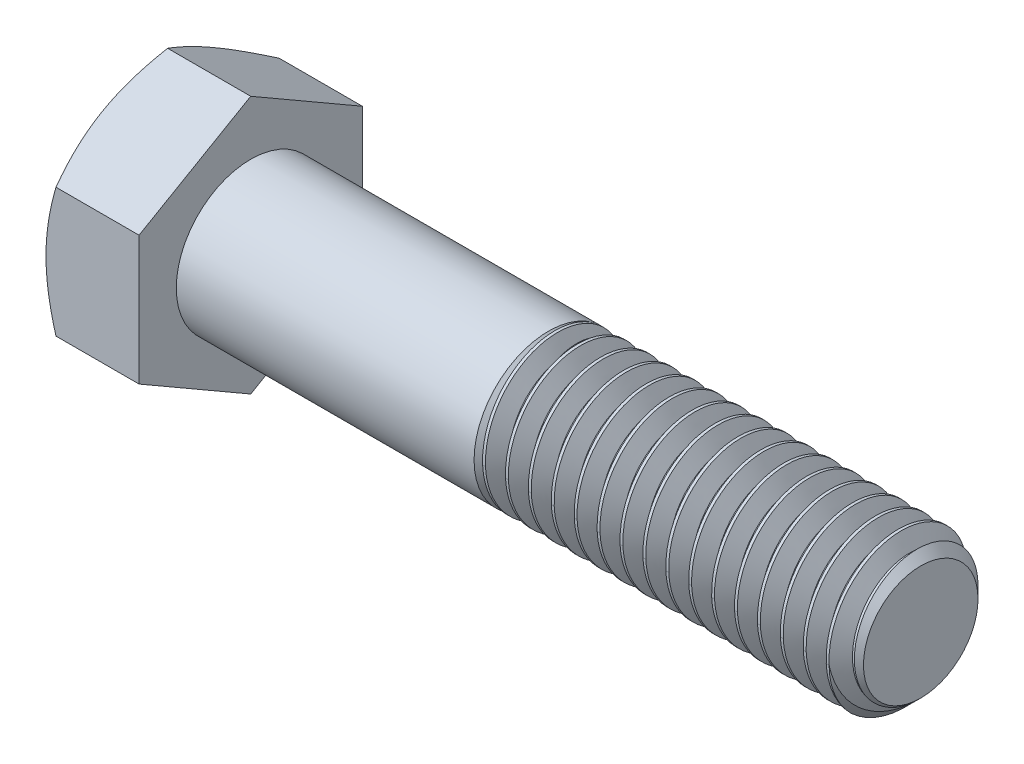
from build123d import *
from build123d.topology import SkipClean

# Parameters (mm, degrees)
SKETCH5_R           = 6.35
BOSS_EXTRUDE3_DEPTH = 57.15
CHAMFER1_SIZE       = 1.465384615
CUT_SWEEP1_PITCH    = 1.953846154
BOSS_EXTRUDE4_DEPTH = 7.9375
SKETCH8_OUTSIDE_W   = 269.808
SKETCH8_OUTSIDE_H   = 272.756
SKETCH8_OUTSIDE_R   = 9.525
CUT_EXTRUDE3_DEPTH  = 67.693896229
CUT_EXTRUDE3_DRAFT  = -60
CUT_EXTRUDE4_DEPTH  = 0.254
CIRPATTERN1_COUNT   = 3


with BuildPart() as part:
    # Sketch5 → Boss-Extrude3 (new body)
    with BuildSketch(Plane(origin=(32.54375, 0, 0), x_dir=(0, 0, -1), z_dir=(1, 0, 0))):
        Circle(SKETCH5_R)
    extrude(amount=-BOSS_EXTRUDE3_DEPTH)

    # Chamfer1
    chamfer1_edges = [part.edges().sort_by_distance(p)[0] for p in [
        (32.54375, 0, 6.35),
    ]]
    chamfer(chamfer1_edges, length=CHAMFER1_SIZE)

    # Cut-Sweep1: the profile of Sketch10 profile screwed along a right-hand helix of 17.25 turns, 10 arcs to a turn; built about Z, then put on its axis
    cut_sweep1_z = Axis((0, 0, 0), (0, 0, 1))
    cut_sweep1_corners = [(6.3503, 0, 0.000173205), (5.080939697, 0, -0.732692308), (5.080939697, 0, -0.976923077), (6.3503, 0, -1.70978859)]
    with BuildLine(mode=Mode.PRIVATE) as cut_sweep1_profile:
        Line(cut_sweep1_corners[0], cut_sweep1_corners[1])
        Line(cut_sweep1_corners[1], cut_sweep1_corners[2])
        Line(cut_sweep1_corners[2], cut_sweep1_corners[3])
        Line(cut_sweep1_corners[3], cut_sweep1_corners[0])
    cut_sweep1_cap = Face(cut_sweep1_profile.wire())
    cut_sweep1_turn_angles = [0, 18, 36, 54, 72, 90, 108, 126, 144, 162, 180, 198, 216, 234, 252, 270, 288, 306, 324, 342, 360]
    cut_sweep1_turn_weights = [1, 0.9510565162951535, 1, 0.9510565162951535, 1, 0.9510565162951535, 1, 0.9510565162951535, 1, 0.9510565162951535, 1, 0.9510565162951535, 1, 0.9510565162951535, 1, 0.9510565162951535, 1, 0.9510565162951535, 1, 0.9510565162951535, 1]
    cut_sweep1_turn_rails = [Edge.make_bspline([Vector(p[0], p[1], 0).rotate(cut_sweep1_z, cut_sweep1_turn_angles[k]) / cut_sweep1_turn_weights[k] + Vector(0, 0, p[2] + CUT_SWEEP1_PITCH * cut_sweep1_turn_angles[k] / 360) for k in range(21)], [0, 0, 0, 1, 1, 2, 2, 3, 3, 4, 4, 5, 5, 6, 6, 7, 7, 8, 8, 9, 9, 10, 10, 10], 2, cut_sweep1_turn_weights) for p in cut_sweep1_corners]
    cut_sweep1_turn_sides = [Face.make_surface_from_curves(cut_sweep1_turn_rails[p[0]], cut_sweep1_turn_rails[p[1]]) for p in [(0, 1), (1, 2), (2, 3), (3, 0)]]
    cut_sweep1_last_angles = [6120, 6138, 6156, 6174, 6192, 6201, 6210]
    cut_sweep1_last_weights = [1, 0.9510565162951535, 1, 0.9510565162951535, 1, 0.9876883405951787, 1]
    cut_sweep1_last_rails = [Edge.make_bspline([Vector(p[0], p[1], 0).rotate(cut_sweep1_z, cut_sweep1_last_angles[k]) / cut_sweep1_last_weights[k] + Vector(0, 0, p[2] + CUT_SWEEP1_PITCH * cut_sweep1_last_angles[k] / 360) for k in range(7)], [0, 0, 0, 1, 1, 2, 2, 3, 3, 3], 2, cut_sweep1_last_weights) for p in cut_sweep1_corners]
    cut_sweep1_last_sides = [Face.make_surface_from_curves(cut_sweep1_last_rails[p[0]], cut_sweep1_last_rails[p[1]]) for p in [(0, 1), (1, 2), (2, 3), (3, 0)]]
    cut_sweep1 = Plane(origin=(32.54375, 0, 0), x_dir=(0, 1, 0), z_dir=(-1, 0, 0)) * Solid(Shell([*[p.moved(Location((0, 0, CUT_SWEEP1_PITCH * i))) for i in range(17) for p in cut_sweep1_turn_sides], *cut_sweep1_last_sides, cut_sweep1_cap, cut_sweep1_cap.rotate(cut_sweep1_z, 6210).moved(Location((0, 0, CUT_SWEEP1_PITCH * 6210 / 360)))]))
    add(cut_sweep1, mode=Mode.SUBTRACT)

    # Sketch11 → Revolve1 (revolve)
    with BuildSketch(Plane.XY, mode=Mode.PRIVATE) as revolve1_sk:
        Polygon((-24.60625, 6.35), (-24.60625, 0), (7.14375, 0), (0.79375, 6.35), align=None)
    revolve(revolve1_sk.sketch.rotate(Axis((-24.60625, 0, 0), (1, 0, 0)), 270), axis=Axis((-24.60625, 0, 0), (1, 0, 0)))

    # Sketch6 → Boss-Extrude4 (add)
    with SkipClean():  # the faces are left unmerged after this step: merging them gives an invalid solid
        with BuildSketch(Plane.ZY.offset(24.60625)):
            Polygon((9.525, 5.499261314), (0, 10.998522628), (-9.525, 5.499261314), (-9.525, -5.499261314), (0, -10.998522628), (9.525, -5.499261314), align=None)
        extrude(amount=BOSS_EXTRUDE4_DEPTH)


with BuildPart() as cut_extrude3_tool:
    # Sketch8 outside → Cut-Extrude3 (with draft: the straight prism first)
    with BuildSketch(Plane.ZY.offset(32.54375)):
        Rectangle(SKETCH8_OUTSIDE_W, SKETCH8_OUTSIDE_H)
        Circle(SKETCH8_OUTSIDE_R, mode=Mode.SUBTRACT)
    extrude(amount=-CUT_EXTRUDE3_DEPTH)
    # Cut-Extrude3: the draft: its side faces are tilted about the plane it starts from
    cut_extrude3_sides = [cut_extrude3_tool.faces().sort_by_distance(p)[0] for p in [
        (1.303198115, -136.378, 0),
        (1.303198115, 0, 134.904),
        (1.303198115, 136.378, 0),
        (1.303198115, 0, -134.904),
        (1.303198115, 0, -9.525),
    ]]
    draft(cut_extrude3_sides, Plane.ZY.offset(32.54375), CUT_EXTRUDE3_DRAFT)


with BuildPart() as part_1:
    add(part.part)

    # Cut-Extrude3: cut by cut_extrude3_tool
    add(cut_extrude3_tool.part, mode=Mode.SUBTRACT)

    # Sketch12 → Cut-Extrude4 (cut)
    with SkipClean():  # the faces are left unmerged after this step: merging them gives an invalid solid
        with BuildSketch(Plane.ZY.offset(32.54375)):
            with BuildLine():
                Line((0.28575, 7.33425), (0.28575, 4.09575))
                ThreePointArc((0.28575, 4.09575), (0, 3.81), (-0.28575, 4.09575))
                Line((-0.28575, 4.09575), (-0.28575, 7.33425))
                ThreePointArc((-0.28575, 7.33425), (0, 7.62), (0.28575, 7.33425))
            make_face()
        cut_extrude4 = extrude(amount=-CUT_EXTRUDE4_DEPTH, mode=Mode.SUBTRACT)

    # CirPattern1: Cut-Extrude4 ×3 about axis
    with SkipClean():  # the faces are left unmerged after this step: merging them gives an invalid solid
        cirpattern1_axis = Axis((0, 0, 0), (1, 0, 0))
        for i in range(1, CIRPATTERN1_COUNT):
            add(cut_extrude4.rotate(cirpattern1_axis, i * 360 / CIRPATTERN1_COUNT), mode=Mode.SUBTRACT)


solid = part_1.part
